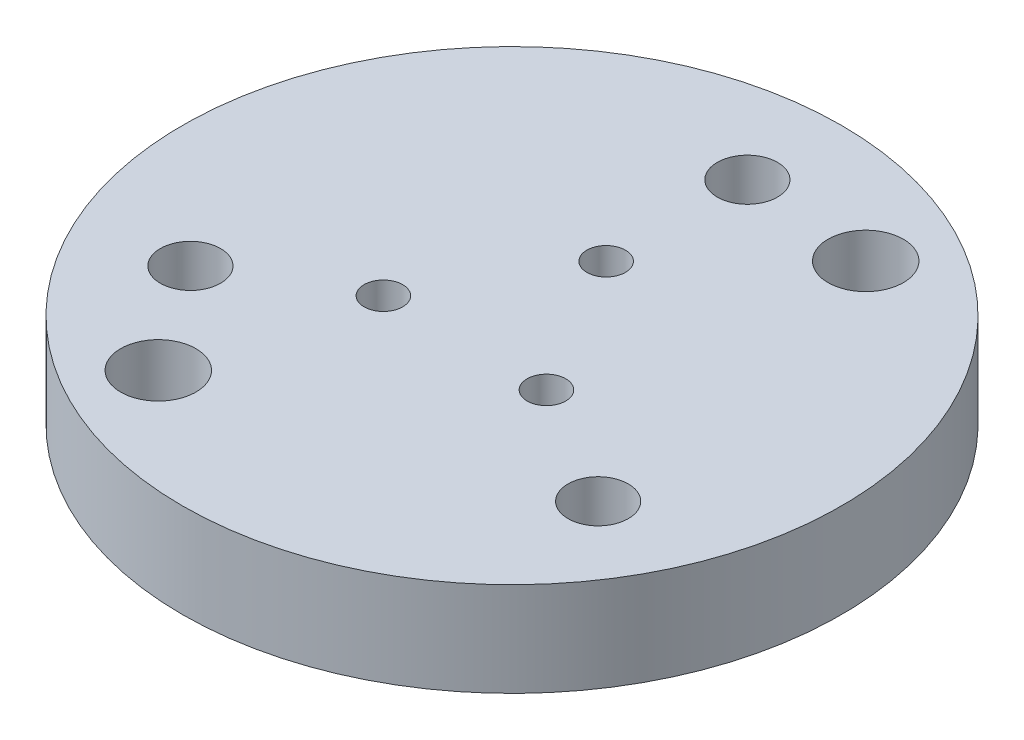
from build123d import *

# Parameters (mm, degrees)
SKETCH1_R             = 35
BOSS_EXTRUDE1_DEPTH   = 10
CUT_EXTRUDE1_REACH    = 52.498
SKETCH2_R             = 2.05
F_8_0MM_DOWEL_HOLE1_D = 8
M6_CLEARANCE_HOLE1_D  = 6.4


with BuildPart() as part:
    # Sketch1 → Boss-Extrude1 (new body)
    with BuildSketch(Plane(origin=(0, 0, 0), x_dir=(1, 0, 0), z_dir=(0, 1, 0))):
        Circle(SKETCH1_R)
    extrude(amount=-BOSS_EXTRUDE1_DEPTH)

    # Sketch2 → Cut-Extrude1 (cut, up to next)
    with BuildSketch(Plane(origin=(0, 0, 0), x_dir=(1, 0, 0), z_dir=(0, 1, 0)), mode=Mode.PRIVATE) as cut_extrude1_sk1:
        with Locations((8.660254038, -5)):
            Circle(SKETCH2_R)
    cut_extrude1_tool1 = extrude(cut_extrude1_sk1.sketch, amount=-CUT_EXTRUDE1_REACH, mode=Mode.PRIVATE) & part.part
    # Sketch2 → Cut-Extrude1 (cut, up to next)
    with BuildSketch(Plane(origin=(0, 0, 0), x_dir=(1, 0, 0), z_dir=(0, 1, 0)), mode=Mode.PRIVATE) as cut_extrude1_sk2:
        with Locations((0, 10)):
            Circle(SKETCH2_R)
    cut_extrude1_tool2 = extrude(cut_extrude1_sk2.sketch, amount=-CUT_EXTRUDE1_REACH, mode=Mode.PRIVATE) & part.part
    # Sketch2 → Cut-Extrude1 (cut, up to next)
    with BuildSketch(Plane(origin=(0, 0, 0), x_dir=(1, 0, 0), z_dir=(0, 1, 0)), mode=Mode.PRIVATE) as cut_extrude1_sk3:
        with Locations((-8.660254038, -5)):
            Circle(SKETCH2_R)
    cut_extrude1_tool3 = extrude(cut_extrude1_sk3.sketch, amount=-CUT_EXTRUDE1_REACH, mode=Mode.PRIVATE) & part.part
    add(cut_extrude1_tool1.solids().sort_by_distance((8.660254, 0, 5))[0], mode=Mode.SUBTRACT)
    add(cut_extrude1_tool2.solids().sort_by_distance((0, 0, -10))[0], mode=Mode.SUBTRACT)
    add(cut_extrude1_tool3.solids().sort_by_distance((-8.660254, 0, 5))[0], mode=Mode.SUBTRACT)

    # Ø8.0mm Dowel Hole1 (through all)
    with Locations(Plane(origin=(0, -10, 0), x_dir=(-1, 0, 0), z_dir=(0, -1, 0))):
        with Locations((-13.75, 23.815698604), (13.75, -23.815698604)):
            Hole(F_8_0MM_DOWEL_HOLE1_D / 2)

    # M6 Clearance Hole1 (through all)
    with Locations(Plane(origin=(0, -10, 0), x_dir=(-1, 0, 0), z_dir=(0, -1, 0))):
        with Locations((-21.650635095, -12.5), (21.650635095, -12.5), (0, 25)):
            Hole(M6_CLEARANCE_HOLE1_D / 2)


solid = part.part
